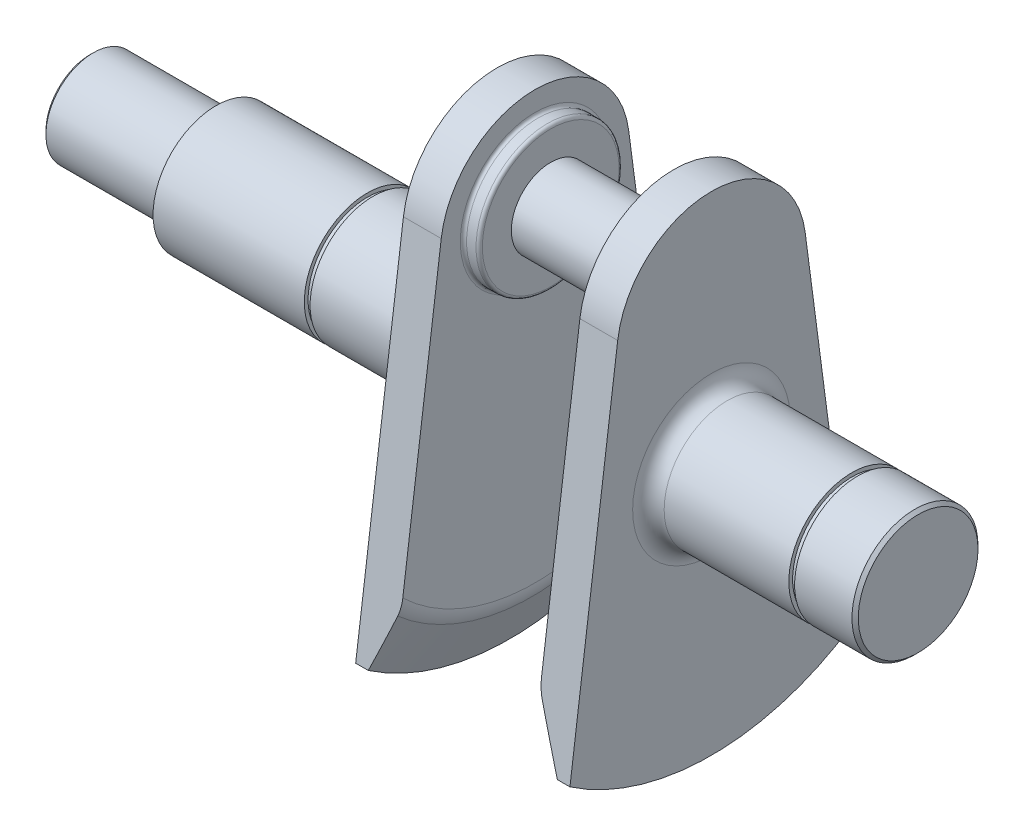
from build123d import *

# Parameters (mm, degrees)
BOSS_EXTRUDE1_DEPTH   = 7.62
SKETCH3_R             = 14.4145
BOSS_EXTRUDE2_DEPTH   = 3.175
SKETCH4_R             = 7.9375
BOSS_EXTRUDE3_DEPTH   = 10.795
CHAMFER1_SIZE         = 5.08
CHAMFER1_SIZE2        = 10.894095156
FILLET1_R             = 6.35
MIRROR1_START         = 117.602
MIRROR1_OUTLINE_R     = 12.7
MIRROR1_DEPTH         = 7.62
MIRROR1_START_2       = 103.632
MIRROR1_2_OUTLINE_R   = 7.9375
MIRROR1_2_DEPTH       = 13.97
MIRROR1_START_3       = 114.427
MIRROR1_3_OUTLINE_R   = 14.4145
MIRROR1_3_OUTLINE_R_2 = 7.9375
MIRROR1_3_DEPTH       = 3.175
MIRROR1_4_ANGLE       = 87.55708
FILLET2_R             = 0.635
CUT_EXTRUDE1_START    = 27.94
SKETCH5_R             = 12.7
CUT_EXTRUDE1_DEPTH    = 27.94
CHAMFER2_SIZE         = 0.635
FILLET3_R             = 3.175


with BuildPart() as part:
    # Sketch1 → Revolve1 (revolve)
    with BuildSketch(Plane.XY, mode=Mode.PRIVATE) as revolve1_sk:
        Polygon((25.4, 12.7), (55.88, 12.7), (55.88, 11.938), (57.0484, 11.938), (57.0484, 12.7), (153.5176, 12.7), (153.5176, 11.938), (154.686, 11.938), (154.686, 12.7), (166.878, 12.7), (166.878, 0), (0, 0), (0, 9.525), (25.4, 9.525), align=None)
    revolve(revolve1_sk.sketch.rotate(Axis((0, 0, 0), (-1, 0, 0)), 90), axis=Axis((0, 0, 0), (-1, 0, 0)))

    # Sketch2 → Boss-Extrude1 (add)
    with BuildSketch(Plane(origin=(82.042, 0, 0), x_dir=(0, 0, -1), z_dir=(1, 0, 0))):
        with BuildLine():
            Line((-18.887024609, 31.061523962), (-28.511597739, -42.044366975))
            ThreePointArc((-28.511597739, -42.044366975), (0, -50.8), (28.511597739, -42.044366975))
            Line((28.511597739, -42.044366975), (18.887024609, 31.061523962))
            ThreePointArc((18.887024609, 31.061523962), (0, 47.625), (-18.887024609, 31.061523962))
        make_face()
    extrude(amount=BOSS_EXTRUDE1_DEPTH)

    # Sketch3 → Boss-Extrude2 (add)
    with BuildSketch(Plane(origin=(89.662, 0, 0), x_dir=(0, 0, -1), z_dir=(1, 0, 0))):
        with Locations((0, 28.575)):
            Circle(SKETCH3_R)
    extrude(amount=BOSS_EXTRUDE2_DEPTH)

    # Sketch4 → Boss-Extrude3 (add)
    with BuildSketch(Plane(origin=(92.837, 0, 0), x_dir=(0, 0, -1), z_dir=(1, 0, 0))):
        with Locations((0, 28.575)):
            Circle(SKETCH4_R)
    extrude(amount=BOSS_EXTRUDE3_DEPTH)

    # Chamfer1
    chamfer1_edges = [part.edges().sort_by_distance(p)[0] for p in [
        (89.662, -50.8, 0),
    ]]
    chamfer1_side = [part.faces().sort_by_distance(p)[0] for p in [
        (85.852, -50.8, 0),
    ]]
    chamfer(chamfer1_edges, length=CHAMFER1_SIZE, length2=CHAMFER1_SIZE2, reference=chamfer1_side[0])

    # Fillet1
    fillet1_edges = [part.edges().sort_by_distance(p)[0] for p in [
        (89.662, -39.905904844, 0),
    ]]
    fillet(fillet1_edges, radius=FILLET1_R)

    # Mirror1: read off the stored shape, not the designer's step
    # Mirror1 outline → Mirror1 (add)
    with BuildSketch(Plane.YZ.offset(MIRROR1_START)):
        with BuildLine():
            Line((31.061523962, 18.887024609), (-42.044366975, 28.511597739))
            ThreePointArc((-42.044366975, 28.511597739), (-50.8, 0), (-42.044366975, -28.511597739))
            Line((-42.044366975, -28.511597739), (31.061523962, -18.887024609))
            ThreePointArc((31.061523962, -18.887024609), (47.625, 0), (31.061523962, 18.887024609))
        make_face()
        Circle(MIRROR1_OUTLINE_R, mode=Mode.SUBTRACT)
    extrude(amount=MIRROR1_DEPTH)

    # Mirror1 2 outline → Mirror1 2 (add)
    with BuildSketch(Plane.YZ.offset(MIRROR1_START_2)):
        with Locations((28.575, 0)):
            Circle(MIRROR1_2_OUTLINE_R)
    extrude(amount=MIRROR1_2_DEPTH)

    # Mirror1 3 outline → Mirror1 3 (add)
    with BuildSketch(Plane.YZ.offset(MIRROR1_START_3)):
        with Locations((28.575, 0)):
            Circle(MIRROR1_3_OUTLINE_R)
        with Locations((28.575, 0)):
            Circle(MIRROR1_3_OUTLINE_R_2, mode=Mode.SUBTRACT)
    extrude(amount=MIRROR1_3_DEPTH)

    # Mirror1 4 outline → Mirror1 4 (revolve, cut)
    with BuildSketch(Plane(origin=(0, 0, 0), x_dir=(0, -0.7220194162000995, 0.6918727936767477), z_dir=(0, 0.6918727936767477, 0.7220194162000995))):
        with BuildLine():
            Line((50.8, 122.682), (41.181769698, 118.196945552))
            ThreePointArc((41.181769698, 118.196945552), (39.872535284, 117.752520355), (38.498143736, 117.602))
            Line((38.498143736, 117.602), (50.8, 117.602))
            Line((50.8, 117.602), (50.8, 122.682))
        make_face()
    revolve(axis=Axis((0, 0, 0), (1, 0, 0)), revolution_arc=MIRROR1_4_ANGLE, mode=Mode.SUBTRACT)

    # Fillet2
    fillet2_edges = [part.edges().sort_by_distance(p)[0] for p in [
        (25.4, 0, 9.525),
        (89.662, 28.575, 14.4145),
        (92.837, 28.575, 14.4145),
        (117.602, 14.1605, 0),
        (114.427, 14.1605, 0),
    ]]
    fillet(fillet2_edges, radius=FILLET2_R)

    # Sketch5 → Cut-Extrude1 (cut)
    with BuildSketch(Plane(origin=(89.662, 0, 0), x_dir=(0, 0, -1), z_dir=(1, 0, 0)).offset(CUT_EXTRUDE1_START)):
        Circle(SKETCH5_R)
    extrude(amount=-CUT_EXTRUDE1_DEPTH, mode=Mode.SUBTRACT)

    # Chamfer2
    chamfer2_edges = [part.edges().sort_by_distance(p)[0] for p in [
        (166.878, 0, 12.7),
        (0, 0, 9.525),
    ]]
    chamfer(chamfer2_edges, length=CHAMFER2_SIZE)

    # Fillet3
    fillet3_edges = [part.edges().sort_by_distance(p)[0] for p in [
        (82.042, 0, 12.7),
        (125.222, 0, 12.7),
    ]]
    fillet(fillet3_edges, radius=FILLET3_R)


solid = part.part
